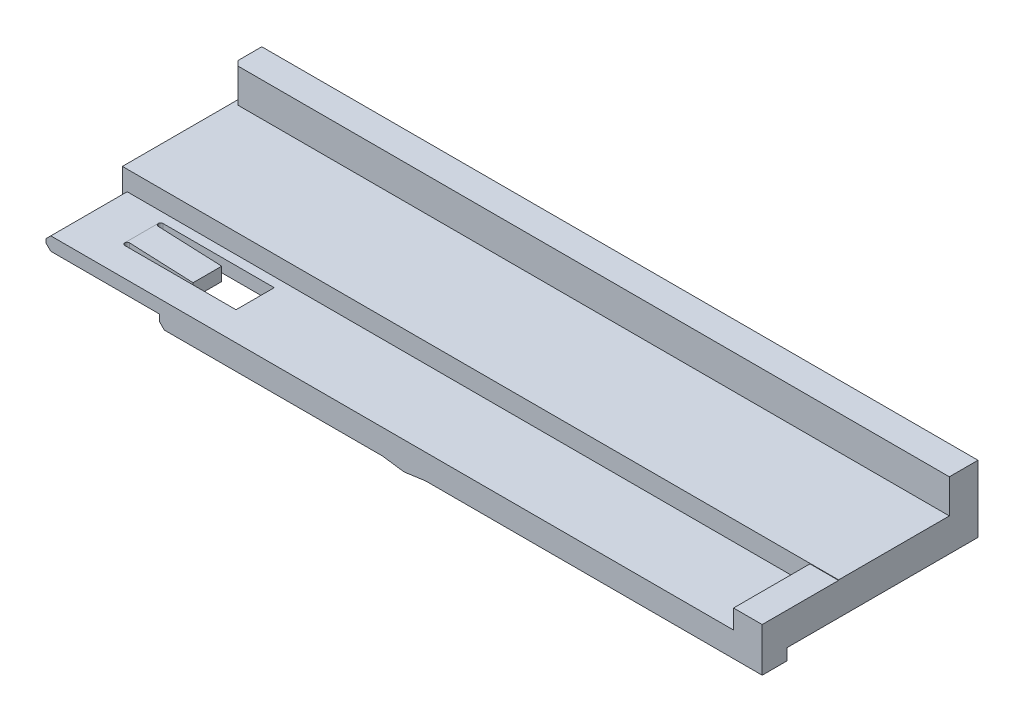
from build123d import *
from OCP.BRepFilletAPI import BRepFilletAPI_MakeChamfer

# Parameters (mm, degrees)
BOSS_EXTRU_1_DEPTH      = 75
ESQUISSE2_W             = 11.9
ESQUISSE2_H             = 4
ENL_V_MAT_EXTRU_1_DEPTH = 10
BOSS_EXTRU_2_START      = 0.5
BOSS_EXTRU_2_DEPTH      = 3
ESQUISSE4_W             = 3
ESQUISSE4_H             = 8
BOSS_EXTRU_3_DEPTH      = 2
ESQUISSE5_W             = 11.9
ESQUISSE5_H             = 1.2
ENL_V_MAT_EXTRU_2_DEPTH = 3
CHANFREIN1_SIZE         = 0.5
CONG_1_R                = 0.25
BOSS_EXTRU_4_DEPTH      = 0.1
CHANFREIN2_SIZE         = 0.3
CHANFREIN2_SIZE_2       = 2.134610917
CHANFREIN3_SIZE         = 0.3
CHANFREIN3_SIZE_2       = 2.134610917


with BuildPart() as part:
    # Esquisse1 → Boss.-Extru.1 (new body)
    with BuildSketch(Plane(origin=(0, 0, 0), x_dir=(0, 0, -1), z_dir=(1, 0, 0))):
        Polygon((0, 0), (0, 2.6), (8, 2.6), (8, 4.65), (19.6, 4.65), (19.6, 8.2), (22.6, 8.2), (22.6, 1.2), (2.6, 1.2), (2.6, 0), align=None)
    extrude(amount=BOSS_EXTRU_1_DEPTH)

    # Esquisse2 → Enlèv. mat.-Extru.1 (cut)
    with BuildSketch(Plane(origin=(0, 2.6, 0), x_dir=(1, 0, 0), z_dir=(0, 1, 0))):
        with Locations((10.95, 5)):
            Rectangle(ESQUISSE2_W, ESQUISSE2_H)
    extrude(amount=-ENL_V_MAT_EXTRU_1_DEPTH, mode=Mode.SUBTRACT)

    # Esquisse3 → Boss.-Extru.2 (add)
    with BuildSketch(Plane.XY.offset(-7).offset(BOSS_EXTRU_2_START)):
        Polygon((5, 2.6), (11.9, 2.3), (11.9, 0.9), (5, 1.2), align=None)
    extrude(amount=BOSS_EXTRU_2_DEPTH)

    # Esquisse4 → Boss.-Extru.3 (add)
    with BuildSketch(Plane(origin=(0, 2.6, 0), x_dir=(1, 0, 0), z_dir=(0, 1, 0))):
        with Locations((73.5, 4)):
            Rectangle(ESQUISSE4_W, ESQUISSE4_H)
    extrude(amount=BOSS_EXTRU_3_DEPTH)

    # Esquisse5 → Enlèv. mat.-Extru.2 (cut)
    with BuildSketch(Plane.XY):
        with Locations((5.95, 0.6)):
            Rectangle(ESQUISSE5_W, ESQUISSE5_H)
    extrude(amount=-ENL_V_MAT_EXTRU_2_DEPTH, mode=Mode.SUBTRACT)

    # Chanfrein1
    chanfrein1_edges = [part.edges().sort_by_distance(p)[0] for p in [
        (0, 2.6, -4),
        (0, 6.425, -19.6),
        (0, 1.2, -11.3),
        (11.9, 0, -1.3),
    ]]
    chamfer(chanfrein1_edges, length=CHANFREIN1_SIZE)

    # Congé1
    cong_1_edges = [part.edges().sort_by_distance(p)[0] for p in [
        (5, 1.9, -7),
        (5, 1.9, -3),
        (5, 1.9, -6.5),
        (5, 1.9, -3.5),
    ]]
    fillet(cong_1_edges, radius=CONG_1_R - 0.0001)  # a hair under: the kernel refuses the full size

    # Esquisse6 → Boss.-Extru.4 (add, symmetric)
    with BuildSketch(Plane(origin=(37.5, 0, 0), x_dir=(0, 0, -1), z_dir=(1, 0, 0))):
        Polygon((0, 0), (0, -0.3), (2.9, -0.3), (2.9, 1.2), (2.6, 1.2), (2.6, 0), align=None)
    extrude(amount=BOSS_EXTRU_4_DEPTH, both=True)

    # Chanfrein2
    chanfrein2_edges_1 = [part.edges().sort_by_distance(p)[0] for p in [
        (37.4, 0.6, -2.6),
    ]]
    chanfrein2_side_1 = [part.faces().sort_by_distance(p)[0] for p in [
        (37.4, 0.6, -2.606),
    ]]
    chanfrein2_edges_2 = [part.edges().sort_by_distance(p)[0] for p in [
        (37.4, 0, -1.3),
    ]]
    chanfrein2_side_2 = [part.faces().sort_by_distance(p)[0] for p in [
        (37.394, 0, -1.3),
    ]]
    chanfrein2 = BRepFilletAPI_MakeChamfer(part.part.solid().wrapped)
    for e in chanfrein2_edges_1:
        chanfrein2.Add(CHANFREIN2_SIZE - 0.0001, CHANFREIN2_SIZE_2 - 0.0001, e.wrapped, chanfrein2_side_1[0].wrapped)
    for e in chanfrein2_edges_2:
        chanfrein2.Add(CHANFREIN2_SIZE_2 - 0.0001, CHANFREIN2_SIZE - 0.0001, e.wrapped, chanfrein2_side_2[0].wrapped)
    add(Compound.cast(chanfrein2.Shape()), mode=Mode.REPLACE)  # a hair under: the kernel refuses the full size

    # Chanfrein3
    chanfrein3_edges_1 = [part.edges().sort_by_distance(p)[0] for p in [
        (37.6, 0.6, -2.6),
    ]]
    chanfrein3_side_1 = [part.faces().sort_by_distance(p)[0] for p in [
        (37.6, 0.6, -2.606),
    ]]
    chanfrein3_edges_2 = [part.edges().sort_by_distance(p)[0] for p in [
        (37.6, 0, -1.3),
    ]]
    chanfrein3_side_2 = [part.faces().sort_by_distance(p)[0] for p in [
        (37.6, -0.006, -1.3),
    ]]
    chanfrein3 = BRepFilletAPI_MakeChamfer(part.part.solid().wrapped)
    for e in chanfrein3_edges_1:
        chanfrein3.Add(CHANFREIN3_SIZE - 0.0001, CHANFREIN3_SIZE_2 - 0.0001, e.wrapped, chanfrein3_side_1[0].wrapped)
    for e in chanfrein3_edges_2:
        chanfrein3.Add(CHANFREIN3_SIZE - 0.0001, CHANFREIN3_SIZE_2 - 0.0001, e.wrapped, chanfrein3_side_2[0].wrapped)
    add(Compound.cast(chanfrein3.Shape()), mode=Mode.REPLACE)  # a hair under: the kernel refuses the full size


solid = part.part
